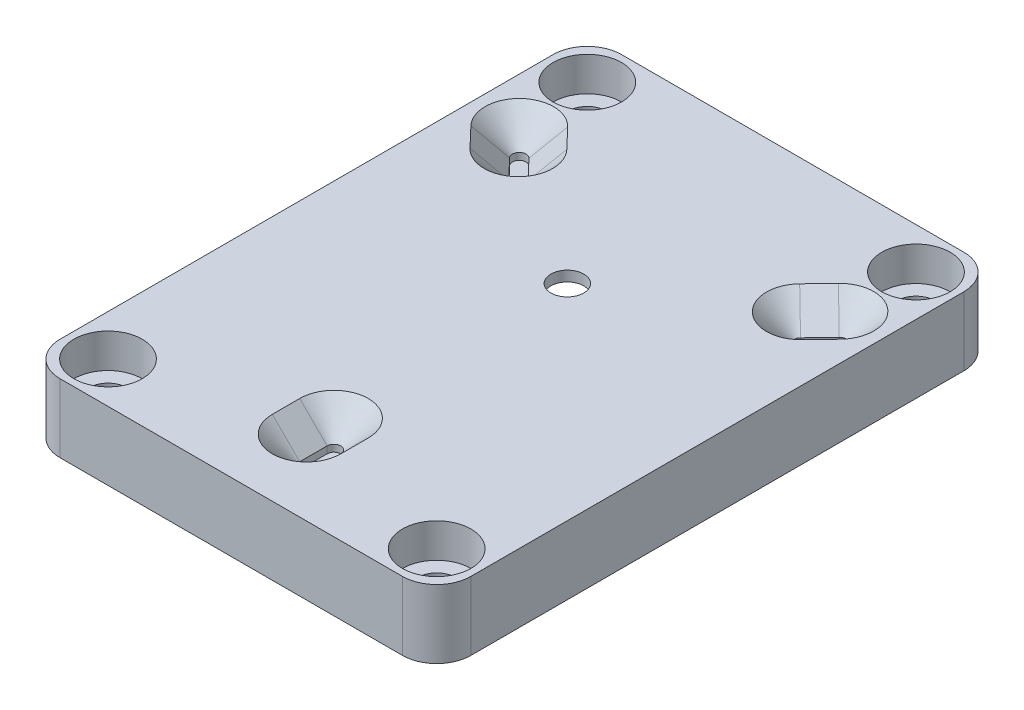
from build123d import *

# Parameters (mm, degrees)
SKETCH1_W                      = 60
SKETCH1_H                      = 82
BOSS_EXTRUDE1_DEPTH            = 10
CUT_EXTRUDE1_DEPTH             = 5
CHAMFER1_SIZE                  = 4
SKETCH4_R                      = 2.4
CUT_EXTRUDE2_DEPTH             = 52.778373864
CUT_EXTRUDE3_START             = -1.5
SKETCH5_R                      = 15
CUT_EXTRUDE3_DEPTH             = 51.278373864
CBORE_FOR_M5_SHCS1_D           = 5.5
CBORE_FOR_M5_SHCS1_CBORE_D     = 10
CBORE_FOR_M5_SHCS1_CBORE_DEPTH = 5
FILLET1_R                      = 5
BOSS_EXTRUDE2_REACH            = 53.778
SKETCH9_R                      = 0.35


with BuildPart() as part:
    # Sketch1 → Boss-Extrude1 (new body)
    with BuildSketch(Plane(origin=(0, 0, 0), x_dir=(1, 0, 0), z_dir=(0, 1, 0))):
        Rectangle(SKETCH1_W, SKETCH1_H)
    extrude(amount=BOSS_EXTRUDE1_DEPTH)

    # Sketch3 → Cut-Extrude1 (cut)
    with BuildSketch(Plane(origin=(0, 10, 0), x_dir=(1, 0, 0), z_dir=(0, 1, 0))):
        with BuildLine():
            Line((-22.659803435, 25.13650636), (-19.894912851, 22.245938932))
            ThreePointArc((-19.894912851, 22.245938932), (-19.926332062, 20.832074429), (-21.340196565, 20.86349364))
            Line((-21.340196565, 20.86349364), (-24.105087149, 23.754061068))
            ThreePointArc((-24.105087149, 23.754061068), (-24.073667938, 25.167925571), (-22.659803435, 25.13650636))
        make_face()
        with BuildLine():
            Line((24.105087149, 23.754061068), (21.340196565, 20.86349364))
            ThreePointArc((21.340196565, 20.86349364), (19.926332062, 20.832074429), (19.894912851, 22.245938932))
            Line((19.894912851, 22.245938932), (22.659803435, 25.13650636))
            ThreePointArc((22.659803435, 25.13650636), (24.073667938, 25.167925571), (24.105087149, 23.754061068))
        make_face()
        with BuildLine():
            Line((-1, -30), (-1, -26))
            ThreePointArc((-1, -26), (0, -25), (1, -26))
            Line((1, -26), (1, -30))
            ThreePointArc((1, -30), (0, -31), (-1, -30))
        make_face()
    extrude(amount=-CUT_EXTRUDE1_DEPTH, mode=Mode.SUBTRACT)

    # Chamfer1
    chamfer1_edges = [part.edges().sort_by_distance(p)[0] for p in [
        (-22.722641857, 10, -22.308777354),
        (-19.926332062, 10, -20.832074429),
        (-24.073667938, 10, -25.167925571),
        (-21.277358143, 10, -23.691222646),
        (-1, 10, 28),
        (0, 10, 31),
        (0, 10, 25),
        (1, 10, 28),
        (21.277358143, 10, -23.691222646),
        (19.926332062, 10, -20.832074429),
        (24.073667938, 10, -25.167925571),
        (22.722641857, 10, -22.308777354),
    ]]
    chamfer(chamfer1_edges, length=CHAMFER1_SIZE)

    # Sketch4 → Cut-Extrude2 (cut, through all)
    with BuildSketch(Plane(origin=(0, 10, 0), x_dir=(1, 0, 0), z_dir=(0, 1, 0))):
        with Locations((0, 8.08)):
            Circle(SKETCH4_R)
    extrude(amount=-CUT_EXTRUDE2_DEPTH, mode=Mode.SUBTRACT)

    # Sketch5 → Cut-Extrude3 (cut, through all)
    with BuildSketch(Plane(origin=(0, 10, 0), x_dir=(1, 0, 0), z_dir=(0, 1, 0)).offset(CUT_EXTRUDE3_START)):
        with Locations((0, 8.08)):
            Circle(SKETCH5_R)
    extrude(amount=-CUT_EXTRUDE3_DEPTH, mode=Mode.SUBTRACT)

    # CBORE for M5 SHCS1 (through all)
    with Locations(Plane(origin=(0, 10, 0), x_dir=(1, 0, 0), z_dir=(0, 1, 0))):
        with Locations((-24, 35), (24, 35), (24, -35), (-24, -35)):
            CounterBoreHole(CBORE_FOR_M5_SHCS1_D / 2, CBORE_FOR_M5_SHCS1_CBORE_D / 2, CBORE_FOR_M5_SHCS1_CBORE_DEPTH)

    # Fillet1
    fillet1_edges = [part.edges().sort_by_distance(p)[0] for p in [
        (30, 5, -41),
        (30, 5, 41),
        (-30, 5, 41),
        (-30, 5, -41),
    ]]
    fillet(fillet1_edges, radius=FILLET1_R)

    # Sketch9 → Boss-Extrude2 (add, up to next)
    with BuildSketch(Plane.XZ, mode=Mode.PRIVATE) as boss_extrude2_sk1:
        with Locations((0, 6.92)):
            Circle(SKETCH9_R)
    boss_extrude2_tool1 = extrude(boss_extrude2_sk1.sketch, amount=-BOSS_EXTRUDE2_REACH, mode=Mode.PRIVATE) - part.part
    # Sketch9 → Boss-Extrude2 (add, up to next)
    with BuildSketch(Plane.XZ, mode=Mode.PRIVATE) as boss_extrude2_sk2:
        with Locations((12.990381057, -15.58)):
            Circle(SKETCH9_R)
    boss_extrude2_tool2 = extrude(boss_extrude2_sk2.sketch, amount=-BOSS_EXTRUDE2_REACH, mode=Mode.PRIVATE) - part.part
    # Sketch9 → Boss-Extrude2 (add, up to next)
    with BuildSketch(Plane.XZ, mode=Mode.PRIVATE) as boss_extrude2_sk3:
        with Locations((-12.990381057, -15.58)):
            Circle(SKETCH9_R)
    boss_extrude2_tool3 = extrude(boss_extrude2_sk3.sketch, amount=-BOSS_EXTRUDE2_REACH, mode=Mode.PRIVATE) - part.part
    add(boss_extrude2_tool1.solids().sort_by_distance((0, 0, 6.92))[0])
    add(boss_extrude2_tool2.solids().sort_by_distance((12.990381, 0, -15.58))[0])
    add(boss_extrude2_tool3.solids().sort_by_distance((-12.990381, 0, -15.58))[0])


solid = part.part
